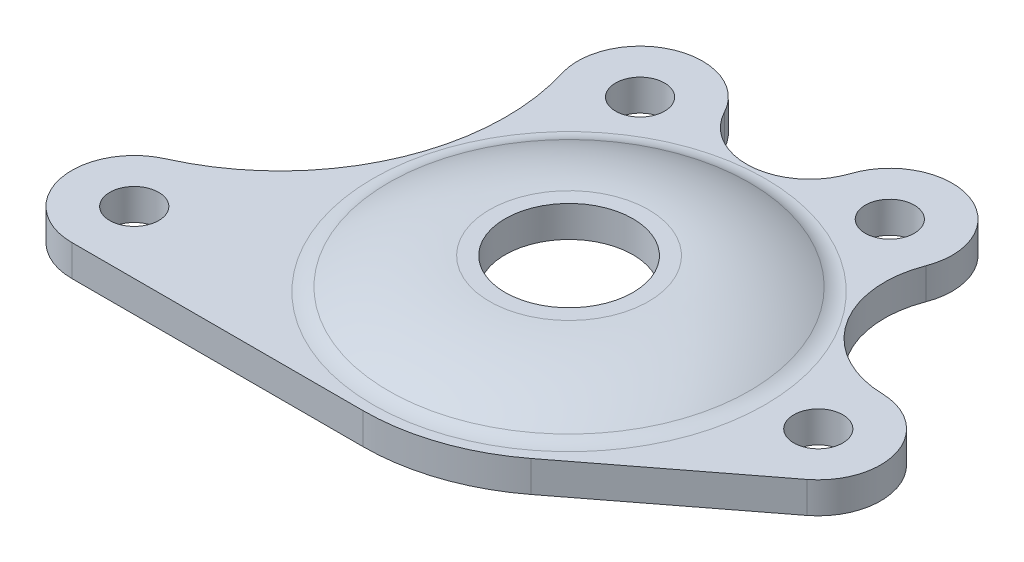
from build123d import *

# Parameters (mm, degrees)
SKETCH47_R                = 2.4892
SKETCH47_R_2              = 6.5
MOTOR_MOUNT_EXTRUDE_DEPTH = 6.35
CUT_EXTRUDE41_DEPTH       = 108.595157342
SKETCH126_R               = 7.6
CUT_EXTRUDE67_DEPTH       = 3.175
FILLET1_R                 = 3.175
FILLET2_R                 = 3.175


with BuildPart() as part:
    # Sketch47 → Motor Mount Extrude------- (new body)
    with BuildSketch(Plane(origin=(0, 25.4, 0), x_dir=(1, 0, 0), z_dir=(0, 1, 0))):
        with BuildLine():
            Line((-87.746629665, -52.146001055), (-71.655228587, -16.794122867))
            ThreePointArc((-71.655228587, -16.794122867), (-66.051255295, -13.07722651), (-60.250494121, -16.478844507))
            ThreePointArc((-60.250494121, -16.478844507), (-54.029624941, -19.900920012), (-48.455644094, -15.503130607))
            ThreePointArc((-48.455644094, -15.503130607), (-40.296945137, -11.501075174), (-36.491885667, -19.753489294))
            ThreePointArc((-36.491885667, -19.753489294), (-35.462620955, -28.838583686), (-27.445846957, -33.235134677))
            ThreePointArc((-27.445846957, -33.235134677), (-21.55821583, -37.612889318), (-23.72910556, -44.621182532))
            Line((-23.72910556, -44.621182532), (-39.596156498, -56.796398937))
            ThreePointArc((-39.596156498, -56.796398937), (-45.616988248, -60.014600555), (-52.352752243, -61.126679691))
            Line((-52.352752243, -61.126679691), (-81.967180737, -61.126679691))
            ThreePointArc((-81.967180737, -61.126679691), (-87.306998587, -58.213079745), (-87.746629665, -52.146001055))
        make_face()
        with Locations((-81.967180737, -54.776679691)):
            Circle(SKETCH47_R, mode=Mode.SUBTRACT)
        with Locations((-65.875779659, -19.424801504)):
            Circle(SKETCH47_R, mode=Mode.SUBTRACT)
        with Locations((-42.422737009, -17.484678513)):
            Circle(SKETCH47_R, mode=Mode.SUBTRACT)
        with Locations((-27.594740634, -39.583388821)):
            Circle(SKETCH47_R, mode=Mode.SUBTRACT)
        with Locations((-52.352752243, -40.171679691)):
            Circle(SKETCH47_R_2, mode=Mode.SUBTRACT)
    extrude(amount=MOTOR_MOUNT_EXTRUDE_DEPTH)

    # Sketch85 → Cut-Extrude41 (cut, through all)
    with BuildSketch(Plane(origin=(0, 31.75, 0), x_dir=(1, 0, 0), z_dir=(0, 1, 0))):
        with BuildLine():
            Line((-71.655228587, -16.794122867), (-87.746629665, -52.146001055))
            ThreePointArc((-87.746629665, -52.146001055), (-86.44125271, -50.270552754), (-84.556533191, -48.978597778))
            ThreePointArc((-84.556533191, -48.978597778), (-73.010983357, -37.515178828), (-71.948733766, -21.279991093))
            ThreePointArc((-71.948733766, -21.279991093), (-72.212231178, -19.010214796), (-71.655228587, -16.794122867))
        make_face()
    extrude(amount=-CUT_EXTRUDE41_DEPTH, mode=Mode.SUBTRACT)

    # Sketch126 → Cut-Extrude67 (cut)
    with BuildSketch(Plane.XZ.offset(-25.4)):
        with Locations((-52.352752243, 40.171679691)):
            Circle(SKETCH126_R)
    extrude(amount=-CUT_EXTRUDE67_DEPTH, mode=Mode.SUBTRACT)

    # Sketch127 → Cut-Revolve1 (revolve, cut)
    with BuildSketch(Plane(origin=(-52.352752243, 0, 0), x_dir=(0, 0, -1), z_dir=(1, 0, 0))):
        with BuildLine():
            Line((-32.084179691, 31.75), (10.628320309, 31.75))
            Line((10.628320309, 31.75), (10.628320309, 28.575))
            Line((10.628320309, 28.575), (-21.121679691, 28.575))
            ThreePointArc((-21.121679691, 28.575), (-26.377669566, 30.940268229), (-32.084179691, 31.75))
        make_face()
        Polygon((-32.571679691, 25.4), (-24.34227064, 25.4), (-28.741679691, 27.94), (-32.571679691, 27.94), align=None)
    revolve(axis=Axis((-52.352752243, 31.75, 40.171679691), (0, 1, 0)), mode=Mode.SUBTRACT)

    # Fillet1
    fillet1_edges = [part.edges().sort_by_distance(p)[0] for p in [
        (-52.352752243, 28.575, 59.221679691),
    ]]
    fillet(fillet1_edges, radius=FILLET1_R)

    # Fillet2
    fillet2_edges = [part.edges().sort_by_distance(p)[0] for p in [
        (-52.352752243, 25.4, 56.001088742),
        (-52.352752243, 27.94, 51.601679691),
    ]]
    fillet(fillet2_edges, radius=FILLET2_R)


solid = part.part
